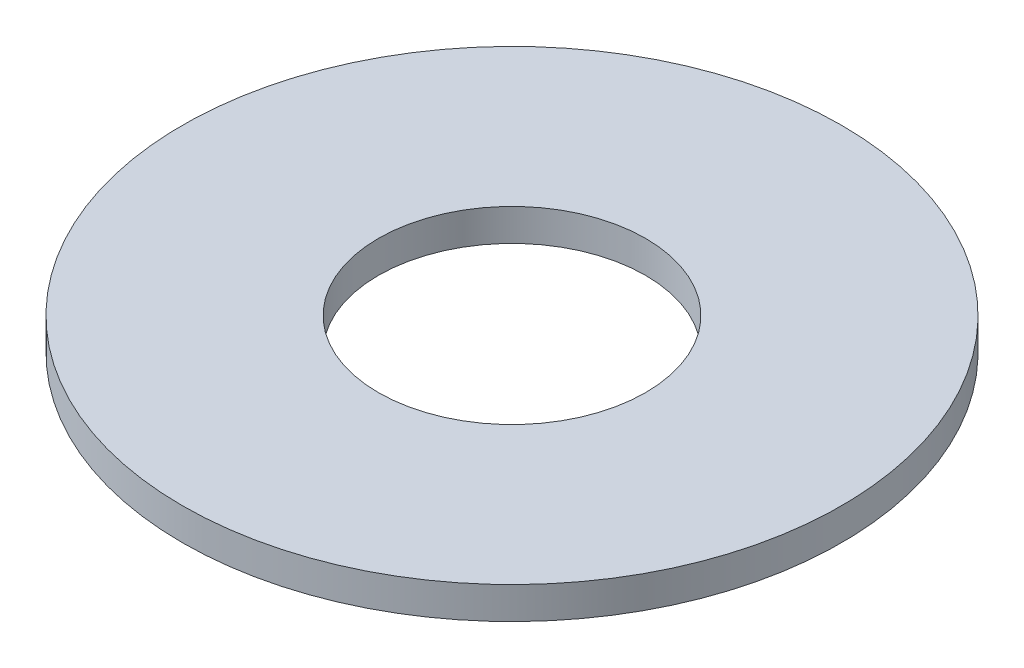
from build123d import *

# Parameters (mm, degrees)
SKETCH1_R           = 92.5
BOSS_EXTRUDE1_DEPTH = 9
SKETCH2_R           = 37.5
CUT_EXTRUDE1_DEPTH  = 132.123987127


with BuildPart() as part:
    # Sketch1 → Boss-Extrude1 (new body)
    with BuildSketch(Plane(origin=(0, 0, 0), x_dir=(1, 0, 0), z_dir=(0, 1, 0))):
        Circle(SKETCH1_R)
    extrude(amount=BOSS_EXTRUDE1_DEPTH)

    # Sketch2 → Cut-Extrude1 (cut, through all)
    with BuildSketch(Plane(origin=(0, 0, 0), x_dir=(1, 0, 0), z_dir=(0, 1, 0))):
        Circle(SKETCH2_R)
    extrude(amount=CUT_EXTRUDE1_DEPTH, mode=Mode.SUBTRACT)


solid = part.part
